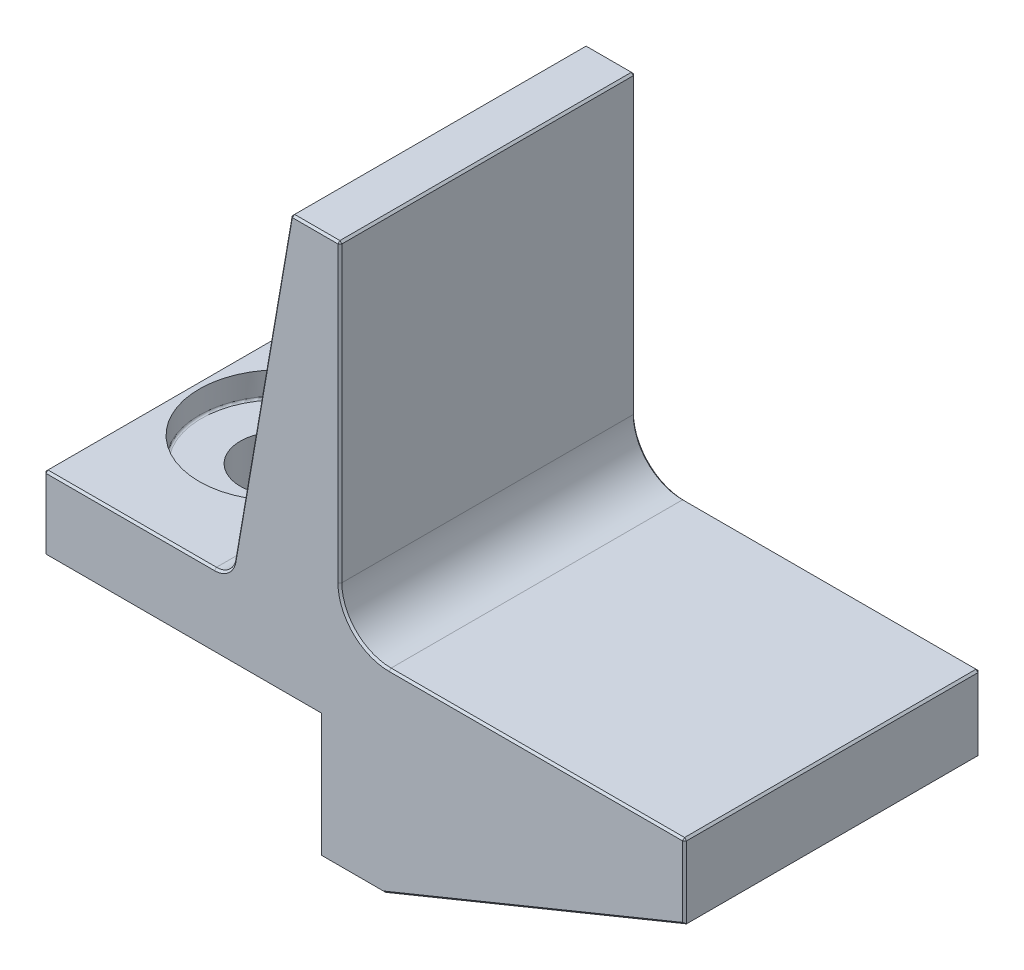
from build123d import *
from OCP.BRepFilletAPI import BRepFilletAPI_MakeChamfer

# Parameters (mm, degrees)
BOSS_EXTRUDE1_DEPTH                                  = 38.1
CBORE_FOR_3_8_BINDING_HEAD_MACHINE_SCREW_D           = 10.0838
CBORE_FOR_3_8_BINDING_HEAD_MACHINE_SCREW_CBORE_D     = 20.6756
CBORE_FOR_3_8_BINDING_HEAD_MACHINE_SCREW_CBORE_DEPTH = 3.175
FILLET1_R                                            = 2.54
FILLET2_R                                            = 6.35
CHAMFER1_SIZE                                        = 0.254
CHAMFER1_SIZE2                                       = 0.311609151
FILLET3_R                                            = 0.254
CHAMFER2_SIZE                                        = 0.254


with BuildPart() as part:
    # Sketch1 → Boss-Extrude1 (new body)
    with BuildSketch(Plane.XY):
        Polygon((0, 0), (44.45, 0), (44.45, -9.525), (5.6541924, -25.4), (-2.6008076, -25.4), (-2.6008076, -9.525), (-38.1608076, -9.525), (-38.1608076, 0), (-14.0308076, 0), (-6.35, 44.45), (0, 44.45), align=None)
    extrude(amount=BOSS_EXTRUDE1_DEPTH)

    # CBORE for 3/8 Binding Head Machine Screw1 (through all)
    with Locations(Plane(origin=(0, 0, 0), x_dir=(1, 0, 0), z_dir=(0, 1, 0))):
        with Locations((-26.8578076, -19.05)):
            CounterBoreHole(CBORE_FOR_3_8_BINDING_HEAD_MACHINE_SCREW_D / 2, CBORE_FOR_3_8_BINDING_HEAD_MACHINE_SCREW_CBORE_D / 2, CBORE_FOR_3_8_BINDING_HEAD_MACHINE_SCREW_CBORE_DEPTH)

    # Fillet1
    fillet1_edges = [part.edges().sort_by_distance(p)[0] for p in [
        (-14.0308076, 0, 19.05),
    ]]
    fillet(fillet1_edges, radius=FILLET1_R)

    # Fillet2
    fillet2_edges = [part.edges().sort_by_distance(p)[0] for p in [
        (0, 0, 19.05),
    ]]
    fillet(fillet2_edges, radius=FILLET2_R)

    # Chamfer1: one chamfer whose edges measure the first distance from different faces: ONE call of the kernel's chamfer builder (chamfer() names one face for all edges)
    chamfer1_edges_1 = [part.edges().sort_by_distance(p)[0] for p in [
        (-6.35, 44.45, 19.05),
    ]]
    chamfer1_side_1 = [part.faces().sort_by_distance(p)[0] for p in [
        (-3.175, 44.45, 19.05),
    ]]
    chamfer1_edges_2 = [part.edges().sort_by_distance(p)[0] for p in [
        (-3.175, 44.45, 0),
        (-3.175, 44.45, 38.1),
        (0, 44.45, 19.05),
        (-10.008318889, 23.27875303, 0),
        (-10.008318889, 23.27875303, 38.1),
        (-14.53353467, 0.597046757, 0),
        (-14.53353467, 0.597046757, 38.1),
        (-27.165176743, 0, 0),
        (-38.1608076, 0, 19.05),
        (-27.165176743, 0, 38.1),
        (-38.1608076, -4.7625, 0),
        (-38.1608076, -9.525, 19.05),
        (-38.1608076, -4.7625, 38.1),
        (-20.3808076, -9.525, 0),
        (-20.3808076, -9.525, 38.1),
        (44.45, -4.7625, 0),
        (44.45, -4.7625, 38.1),
        (44.45, 0, 19.05),
        (25.4, 0, 0),
        (1.859871939, 1.859871939, 0),
        (1.859871939, 1.859871939, 38.1),
        (0, 25.4, 0),
        (0, 25.4, 38.1),
        (25.4, 0, 38.1),
        (-2.6008076, -17.4625, 0),
        (-2.6008076, -17.4625, 38.1),
        (1.5266924, -25.4, 0),
        (1.5266924, -25.4, 38.1),
        (25.0520962, -17.4625, 0),
        (25.0520962, -17.4625, 38.1),
    ]]
    chamfer1 = BRepFilletAPI_MakeChamfer(part.part.solid().wrapped)
    for e in chamfer1_edges_1:
        chamfer1.Add(CHAMFER1_SIZE, CHAMFER1_SIZE2, e.wrapped, chamfer1_side_1[0].wrapped)  # the first distance lies on this face
    for e in chamfer1_edges_2:
        chamfer1.Add(CHAMFER1_SIZE, e.wrapped)
    add(Compound.cast(chamfer1.Shape()), mode=Mode.REPLACE)

    # Fillet3
    fillet3_edges = [part.edges().sort_by_distance(p)[0] for p in [
        (-37.1956076, -3.175, 19.05),
    ]]
    fillet(fillet3_edges, radius=FILLET3_R)

    # Chamfer2
    chamfer2_edges = [part.edges().sort_by_distance(p)[0] for p in [
        (-21.8159076, -9.525, 19.05),
    ]]
    chamfer(chamfer2_edges, length=CHAMFER2_SIZE)


solid = part.part
